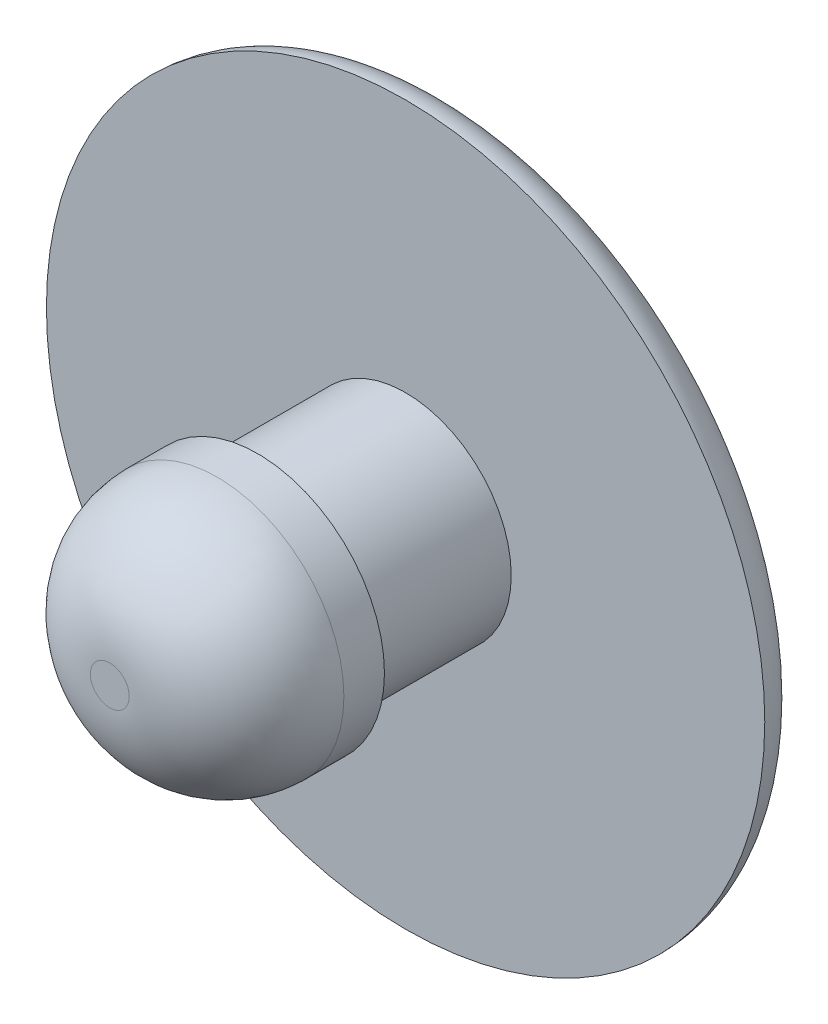
from build123d import *

# Parameters (mm, degrees)
SKETCH1_R           = 4.25
BOSS_EXTRUDE1_DEPTH = 0.5
FILLET1_R           = 0.508
SKETCH2_R           = 1.25
BOSS_EXTRUDE2_DEPTH = 1.75
SKETCH3_R           = 1.5
BOSS_EXTRUDE3_DEPTH = 1.75
FILLET2_R           = 1.27


with BuildPart() as part:
    # Sketch1 → Boss-Extrude1 (new body)
    with BuildSketch(Plane.XY):
        Circle(SKETCH1_R)
    extrude(amount=BOSS_EXTRUDE1_DEPTH)

    # Fillet1
    # the kernel refuses this fillet: 0.508 mm, written as the material it takes off along each edge
    with BuildSketch(Plane(origin=(0, 0, 0), x_dir=(1, 0, 0), z_dir=(0, -1, 0))) as fillet1_piece_1:
        with BuildLine():
            CenterArc((4.25 - FILLET1_R, FILLET1_R), FILLET1_R, 270, 90)
            Line((4.25 - FILLET1_R, 0), (4.25, 0))
            Line((4.25, 0), (4.25, FILLET1_R))
        make_face()
    revolve(axis=Axis((0, 0, 0), (0, 0, 1)), mode=Mode.SUBTRACT)

    # Sketch2 → Boss-Extrude2 (add)
    with BuildSketch(Plane.XY.offset(0.5)):
        Circle(SKETCH2_R)
    extrude(amount=BOSS_EXTRUDE2_DEPTH)

    # Sketch3 → Boss-Extrude3 (add)
    with BuildSketch(Plane.XY.offset(2.25)):
        Circle(SKETCH3_R)
    extrude(amount=BOSS_EXTRUDE3_DEPTH)

    # Fillet2
    fillet2_edges = [part.edges().sort_by_distance(p)[0] for p in [
        (-1.5, 0, 4),
    ]]
    fillet(fillet2_edges, radius=FILLET2_R)


solid = part.part
